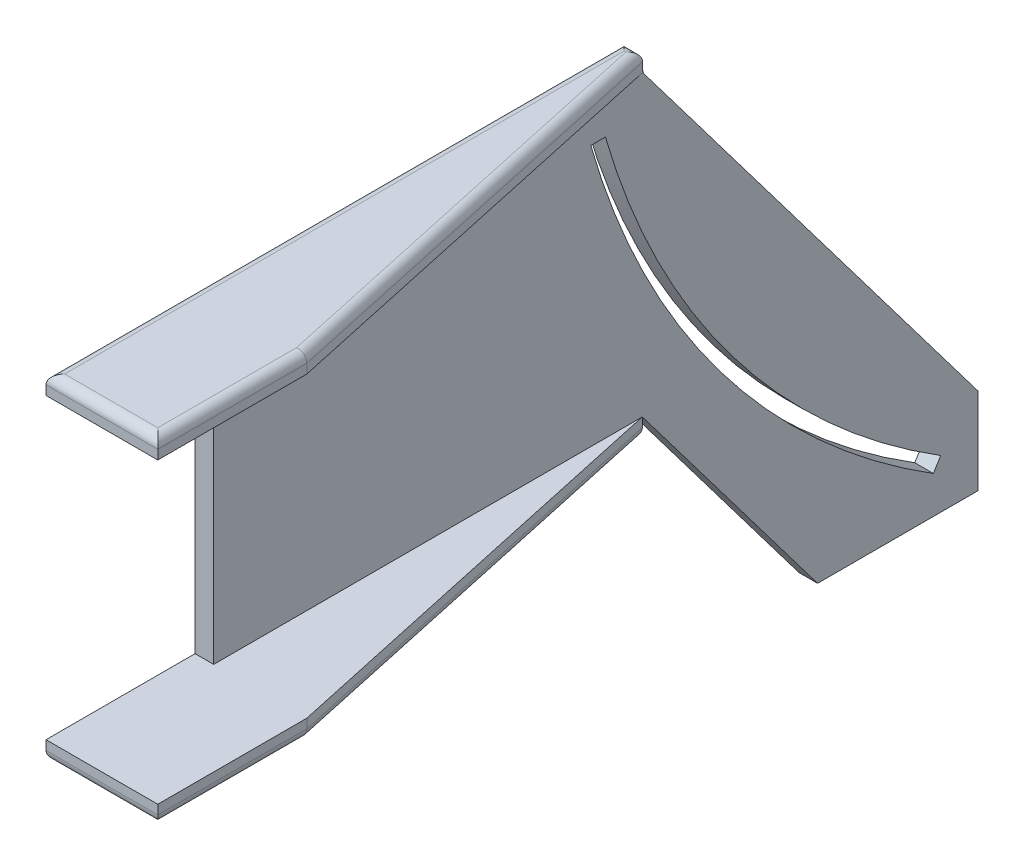
from build123d import *

# Parameters (mm, degrees)
BOSS_EXTRUDE1_DEPTH = 3.175
BOSS_EXTRUDE2_DEPTH = 3.175
FILLET1_R           = 1.5875
BOSS_EXTRUDE3_DEPTH = 3.175
FILLET2_R           = 1.5875


with BuildPart() as part:
    # Sketch1 → Boss-Extrude1 (new body)
    with BuildSketch(Plane(origin=(0, 0, 0), x_dir=(0, 0, -1), z_dir=(1, 0, 0))):
        Polygon((-120.564627305, -30.226), (-63.414627305, -105.80178633), (-63.414627305, -120.523753631), (-90.752572968, -120.523753631), (-120.620560185, -81.026), (-193.675, -81.026), (-193.675, -30.226), align=None)
        with BuildLine():
            Line((-129.390973316, -36.576), (-126.914627305, -36.576))
            ThreePointArc((-126.914627305, -36.576), (-105.349927235, -79.665043976), (-69.764627305, -112.15178633))
            Line((-69.764627305, -112.15178633), (-71.022403038, -114.173753631))
            ThreePointArc((-71.022403038, -114.173753631), (-107.455726685, -80.827560609), (-129.390973316, -36.576))
        make_face(mode=Mode.SUBTRACT)
    extrude(amount=BOSS_EXTRUDE1_DEPTH)

    # Sketch2 → Boss-Extrude2 (add)
    with BuildSketch(Plane(origin=(0, -30.226, 0), x_dir=(1, 0, 0), z_dir=(0, 1, 0))):
        Polygon((0, -120.564627305), (3.175, -120.564627305), (19.05, -193.675), (19.05, -219.075), (0, -219.075), align=None)
    extrude(amount=BOSS_EXTRUDE2_DEPTH)

    # Fillet1
    # the kernel refuses this fillet: 1.5875 mm, written as the material it adds along each edge
    with BuildSketch(Plane(origin=(0, -30.226, 120.564627305), x_dir=(0, -0.7976221020191943, -0.6031575104153825), z_dir=(1, 0, 0))) as fillet1_piece_1:
        with BuildLine():
            CenterArc((FILLET1_R * 0.335530760185, FILLET1_R), FILLET1_R, 232.903626037, 37.096373963)
            Line((-FILLET1_R * 0.267626750231, FILLET1_R * 0.202377897981), (0, 0))
            Line((0, 0), (FILLET1_R * 0.335530760185, 0))
        make_face()
    extrude(amount=3.175)
    # the kernel refuses this fillet: 1.5875 mm, written as the material it takes off along each edge
    with BuildSketch(Plane(origin=(0, -27.051, 223.04375), x_dir=(0, -1, 0), z_dir=(0, 0, -1))) as fillet1_2_piece_1:
        with BuildLine():
            CenterArc((FILLET1_R, -FILLET1_R), FILLET1_R, 90, 90)
            Line((0, -FILLET1_R), (0, 0))
            Line((0, 0), (FILLET1_R, 0))
        make_face()
    extrude(amount=106.447872695, mode=Mode.SUBTRACT)
    with BuildSketch(Plane(origin=(23.01875, -27.051, 219.075), x_dir=(0, -1, 0), z_dir=(-1, 0, 0))) as fillet1_2_piece_2:
        with BuildLine():
            CenterArc((FILLET1_R, -FILLET1_R), FILLET1_R, 90, 90)
            Line((0, -FILLET1_R), (0, 0))
            Line((0, 0), (FILLET1_R, 0))
        make_face()
    extrude(amount=26.9875, mode=Mode.SUBTRACT)
    with BuildSketch(Plane(origin=(19.05, -27.051, 189.70625), x_dir=(-1, 0, 0), z_dir=(0, 0, 1))) as fillet1_2_piece_3:
        with BuildLine():
            CenterArc((FILLET1_R, FILLET1_R), FILLET1_R, 180, 90)
            Line((0, FILLET1_R), (0, 0))
            Line((0, 0), (FILLET1_R, 0))
        make_face()
    extrude(amount=33.3375, mode=Mode.SUBTRACT)
    with BuildSketch(Plane(origin=(2.332859982, -27.051, 116.686254354), x_dir=(-0.9772278303307078, 0, 0.21219276054365557), z_dir=(0.21219276054365557, 0, 0.9772278303307079))) as fillet1_2_piece_4:
        with BuildLine():
            CenterArc((FILLET1_R, FILLET1_R), FILLET1_R, 180, 90)
            Line((0, FILLET1_R), (0, 0))
            Line((0, 0), (FILLET1_R, 0))
        make_face()
    extrude(amount=82.751550957, mode=Mode.SUBTRACT)
    with BuildSketch(Plane(origin=(-3.96875, -27.051, 120.564627305), x_dir=(0, 0, 1), z_dir=(1, 0, 0))) as fillet1_2_piece_5:
        with BuildLine():
            CenterArc((FILLET1_R, FILLET1_R), FILLET1_R, 180, 90)
            Line((0, FILLET1_R), (0, 0))
            Line((0, 0), (FILLET1_R, 0))
        make_face()
    extrude(amount=11.1125, mode=Mode.SUBTRACT)

    # Sketch4 → Boss-Extrude3 (add)
    with BuildSketch(Plane.XZ.offset(81.026)):
        Polygon((0, 120.620560185), (3.175, 120.620560185), (19.05, 193.675), (19.05, 219.075), (0, 219.075), align=None)
    extrude(amount=BOSS_EXTRUDE3_DEPTH)

    # Fillet2
    fillet2_edges = [part.edges().sort_by_distance(p)[0] for p in [
        (0, -84.201, 169.847780093),
        (1.5875, -84.201, 120.620560185),
        (11.1125, -84.201, 157.147780093),
        (19.05, -84.201, 206.375),
        (9.525, -84.201, 219.075),
    ]]
    fillet(fillet2_edges, radius=FILLET2_R)


solid = part.part
